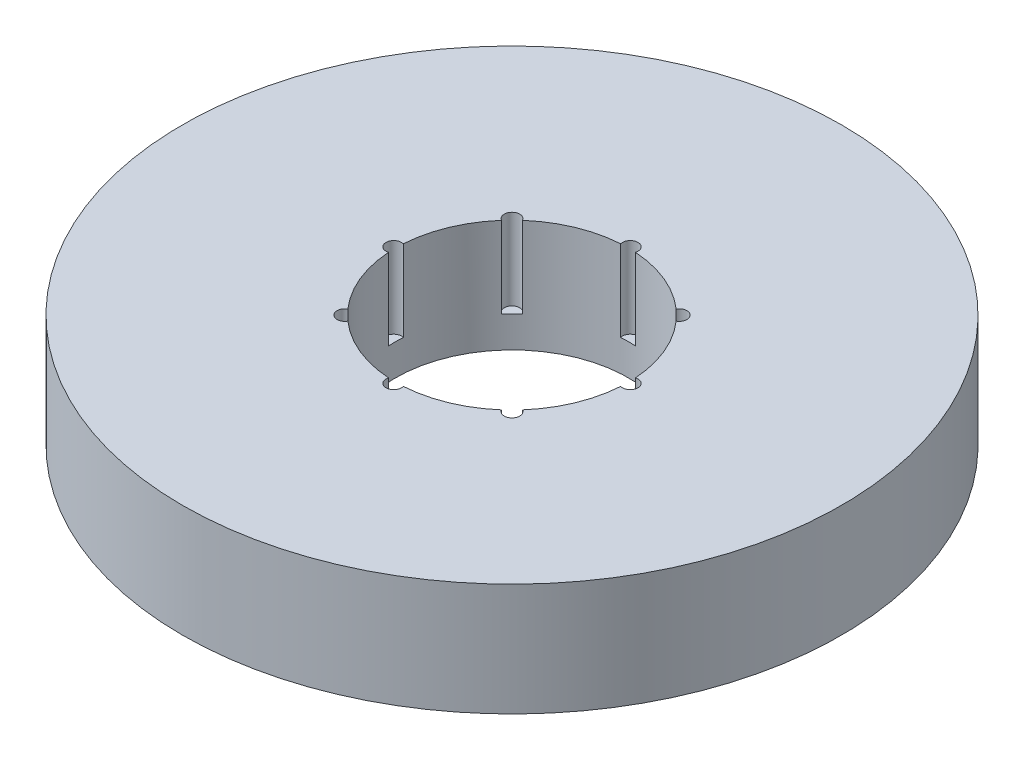
from build123d import *

# Parameters (mm, degrees)
SKETCH1_R           = 85
BOSS_EXTRUDE1_DEPTH = 29
SKETCH2_R           = 30
CUT_EXTRUDE1_DEPTH  = 124.656783073
SKETCH3_R           = 1.986241111
CUT_EXTRUDE2_DEPTH  = 20.92162729
CIRPATTERN1_COUNT   = 8


with BuildPart() as part:
    # Sketch1 → Boss-Extrude1 (new body)
    with BuildSketch(Plane(origin=(0, 0, 0), x_dir=(1, 0, 0), z_dir=(0, 1, 0))):
        Circle(SKETCH1_R)
    extrude(amount=BOSS_EXTRUDE1_DEPTH)

    # Sketch2 → Cut-Extrude1 (cut, through all)
    with BuildSketch(Plane(origin=(0, 0, 0), x_dir=(1, 0, 0), z_dir=(0, 1, 0))):
        Circle(SKETCH2_R)
    extrude(amount=CUT_EXTRUDE1_DEPTH, mode=Mode.SUBTRACT)

    # Sketch3 → Cut-Extrude2 (cut)
    with BuildSketch(Plane(origin=(0, 29, 0), x_dir=(1, 0, 0), z_dir=(0, 1, 0))):
        with Locations((-30.50147061, 0)):
            Circle(SKETCH3_R)
    cut_extrude2 = extrude(amount=-CUT_EXTRUDE2_DEPTH, mode=Mode.SUBTRACT)

    # CirPattern1: Cut-Extrude2 ×8 about axis
    cirpattern1_axis = Axis((0, 0, 0), (0, 1, 0))
    for i in range(1, CIRPATTERN1_COUNT):
        add(cut_extrude2.rotate(cirpattern1_axis, i * 360 / CIRPATTERN1_COUNT), mode=Mode.SUBTRACT)


solid = part.part
